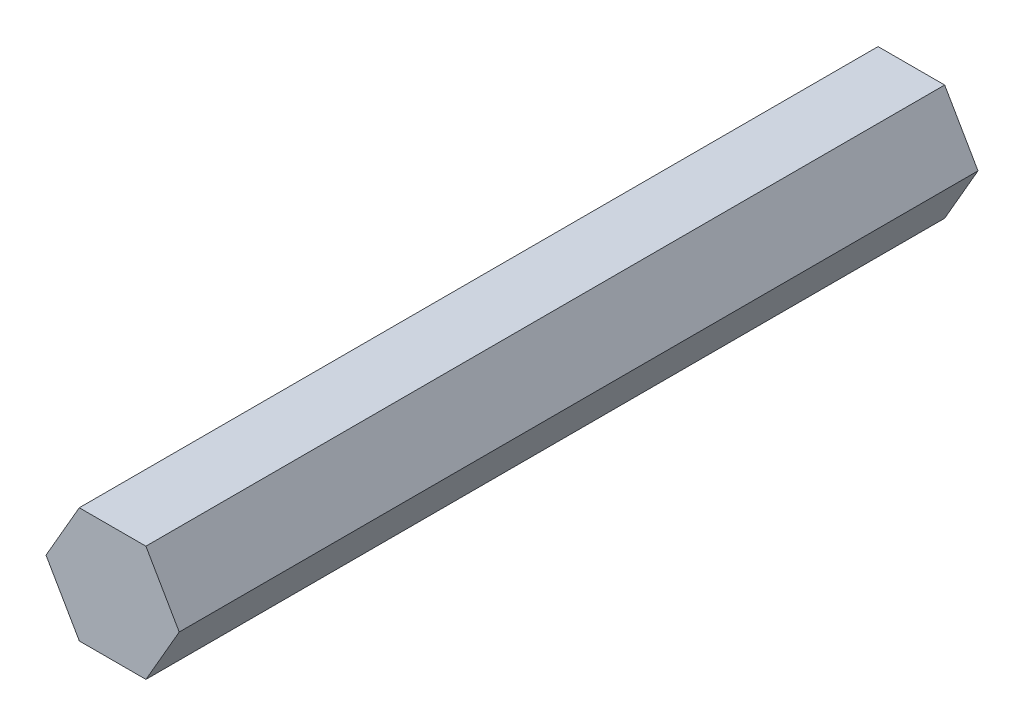
from build123d import *

# Parameters (mm, degrees)
BOSS_EXTRUDE1_DEPTH = 152.4


with BuildPart() as part:
    # Sketch1 → Boss-Extrude1 (new body)
    with BuildSketch(Plane.XY):
        Polygon((-12.709097937, -0.005252697), (-6.35, -11.009028021), (6.359097937, -11.003775325), (12.709097937, 0.005252697), (6.35, 11.009028021), (-6.359097937, 11.003775325), align=None)
    extrude(amount=BOSS_EXTRUDE1_DEPTH)


solid = part.part
